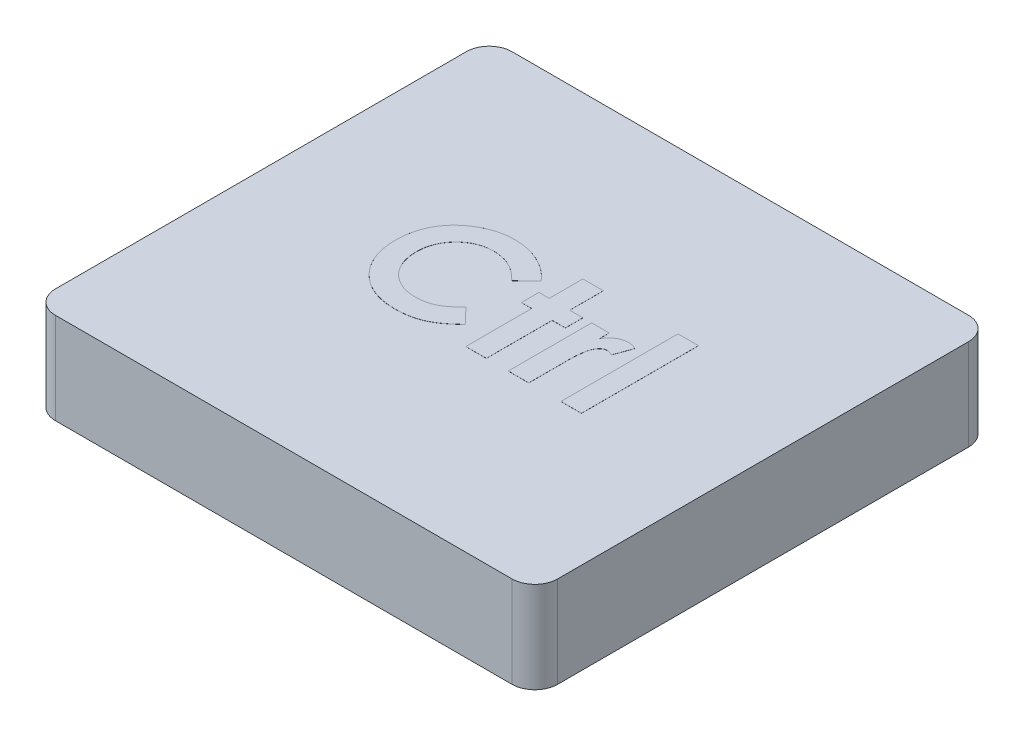
from build123d import *

# Parameters (mm, degrees)
SKETCH1_W           = 13.97
SKETCH1_H           = 12.7
BOSS_EXTRUDE1_DEPTH = 2.54
FILLET1_R           = 0.635
SHELL1_START        = 0.635
SHELL1_OUTLINE_W    = 1.905
SHELL1_OUTLINE_H    = 11.43
SHELL1_DEPTH        = 12.7
SKETCH2_R           = 2.54
BOSS_EXTRUDE2_DEPTH = 1.905
SKETCH3_W           = 0.569871795
SKETCH3_H           = 3.256410256
BOSS_EXTRUDE3_DEPTH = 0.00254


# Read off the part's stored shape, not the designer's step: Shell1
with BuildPart() as part:
    # Sketch1 → Boss-Extrude1 (new body)
    with BuildSketch(Plane(origin=(0, 0, 0), x_dir=(1, 0, 0), z_dir=(0, 1, 0))):
        with Locations((6.985, 6.35)):
            Rectangle(SKETCH1_W, SKETCH1_H)
    extrude(amount=BOSS_EXTRUDE1_DEPTH)

    # Fillet1
    fillet1_edges = [part.edges().sort_by_distance(p)[0] for p in [
        (0, 1.27, -12.7),
        (13.97, 1.27, -12.7),
        (13.97, 1.27, 0),
        (0, 1.27, 0),
    ]]
    fillet(fillet1_edges, radius=FILLET1_R)

    # Shell1 outline → Shell1 (cut)
    with BuildSketch(Plane.YZ.offset(SHELL1_START)):
        with Locations((0.9525, -6.35)):
            Rectangle(SHELL1_OUTLINE_W, SHELL1_OUTLINE_H)
    extrude(amount=SHELL1_DEPTH, mode=Mode.SUBTRACT)

    # Sketch2 → Boss-Extrude2 (add)
    with BuildSketch(Plane(origin=(0, 1.905, 0), x_dir=(-1, 0, 0), z_dir=(0, -1, 0))):
        with Locations(Location((-6.985, 6.35, 0), (0, 0, 270))):
            Circle(SKETCH2_R)
    extrude(amount=BOSS_EXTRUDE2_DEPTH)

    # Sketch3 → Boss-Extrude3 (add)
    with BuildSketch(Plane(origin=(0, 2.54, 0), x_dir=(1, 0, 0), z_dir=(0, 1, 0))):
        with BuildLine():
            Line((6.568505128, 7.577208734), (6.150641546, 7.177789663))
            add(Edge.make_bspline(
                [(6.150641546, 7.177789663), (6.115194953, 7.2144415), (6.045956652, 7.28603402), (5.934387691, 7.380816208), (5.818360035, 7.459804336), (5.700130769, 7.526327635), (5.577573291, 7.576657252), (5.452104701, 7.613333291), (5.322923843, 7.635693286), (5.235499207, 7.638251666), (5.191526963, 7.639538462)],
                knots=[0, 0, 0, 0, 1.115251505, 2.178435587, 3.19620269, 4.182487026, 5.141301733, 6.088180966, 7.038406374, 8, 8, 8, 8], degree=3))
            add(Edge.make_bspline(
                [(5.191526963, 7.639538462), (5.154804796, 7.638521848), (5.082337645, 7.636515672), (4.975936877, 7.621808428), (4.874159044, 7.596798119), (4.776655743, 7.562329281), (4.683713883, 7.517728433), (4.5951386, 7.463030097), (4.511148271, 7.398728275), (4.432852361, 7.325155668), (4.361230014, 7.244772066), (4.29794711, 7.159002955), (4.244937527, 7.068044826), (4.201433425, 6.972818837), (4.16754541, 6.872884235), (4.143345111, 6.7683083), (4.129348304, 6.658966489), (4.127259187, 6.584636741), (4.126197436, 6.546860176)],
                knots=[0, 0, 0, 0, 1.035432265, 2.043311493, 3.022114605, 3.98653278, 4.95457646, 5.923598177, 6.917315552, 7.932509744, 8.948865224, 9.949768934, 10.933144597, 11.912367597, 12.897413939, 13.903909035, 14.934704909, 16, 16, 16, 16], degree=3))
            add(Edge.make_bspline(
                [(4.126197436, 6.546860176), (4.12650342, 6.52034594), (4.127106522, 6.468085836), (4.133708537, 6.390778637), (4.144339337, 6.315772378), (4.159724739, 6.243180674), (4.178964335, 6.172940615), (4.201536762, 6.104446244), (4.229853539, 6.038643999), (4.26128559, 5.974769629), (4.297840702, 5.914566028), (4.337253857, 5.857156898), (4.379990988, 5.802823652), (4.426328908, 5.751788408), (4.476919763, 5.704848731), (4.530455968, 5.660593089), (4.587840605, 5.620129351), (4.647881648, 5.582442035), (4.711097778, 5.549702743), (4.775773793, 5.52004727), (4.842890313, 5.495962616), (4.911630153, 5.476548188), (4.981747662, 5.460039117), (5.053928654, 5.449873974), (5.12754741, 5.442176031), (5.177301332, 5.441700728), (5.202339263, 5.441461538)],
                knots=[0, 0, 0, 0, 1.103660481, 2.175337485, 3.227646561, 4.255952547, 5.262355991, 6.258840057, 7.255597736, 8.242457506, 9.22035537, 10.185017736, 11.140346927, 12.096287581, 13.051739095, 14.01125915, 14.986044842, 15.97314143, 16.960198552, 17.947847494, 18.933482797, 19.925264591, 20.920966487, 21.929612487, 22.958107872, 24, 24, 24, 24], degree=3))
            add(Edge.make_bspline(
                [(5.202339263, 5.441461538), (5.244807897, 5.442689957), (5.328247719, 5.445103479), (5.450707656, 5.463976883), (5.567399775, 5.495022564), (5.66063622, 5.53168571), (5.733684512, 5.567891042), (5.789295097, 5.601379191), (5.846800776, 5.638839363), (5.905246429, 5.681685345), (5.965289454, 5.729402968), (6.025869952, 5.783037337), (6.088538796, 5.840822348), (6.129592535, 5.882064647), (6.150641546, 5.903210337)],
                knots=[0, 0, 0, 0, 1.404581149, 2.759636711, 4.088442092, 5.392261763, 6.066678138, 6.783632037, 7.538459478, 8.336747902, 9.180226004, 10.074962426, 11.012997595, 12, 12, 12, 12], degree=3))
            Line((6.150641546, 5.903210337), (6.555784776, 5.477714543))
            add(Edge.make_bspline(
                [(6.555784776, 5.477714543), (6.527305387, 5.450218588), (6.471719712, 5.396552363), (6.387870264, 5.320351332), (6.304126343, 5.251876235), (6.222511029, 5.188641725), (6.141687378, 5.132489979), (6.06166396, 5.083364915), (5.983346676, 5.04002409), (5.905109243, 5.003198427), (5.826464826, 4.971929614), (5.745548963, 4.945009219), (5.662114287, 4.922235533), (5.575651216, 4.903860159), (5.486966225, 4.88912559), (5.395229341, 4.879179841), (5.301022221, 4.872493645), (5.237120072, 4.871892834), (5.204883333, 4.871589744)],
                knots=[0, 0, 0, 0, 1.244526981, 2.429050516, 3.560637417, 4.644440555, 5.67424972, 6.652764056, 7.595344123, 8.486817594, 9.369275933, 10.254498637, 11.166417451, 12.086725134, 13.032340136, 13.991389299, 14.986715468, 16, 16, 16, 16], degree=3))
            add(Edge.make_bspline(
                [(5.204883333, 4.871589744), (5.145668437, 4.873099249), (5.029801344, 4.876052933), (4.86000114, 4.897937726), (4.698695505, 4.934627196), (4.545492012, 4.986516227), (4.400439375, 5.052802032), (4.263574704, 5.134065316), (4.135118595, 5.230090176), (4.016108719, 5.339751107), (3.908458622, 5.460862399), (3.813308403, 5.590902701), (3.734600139, 5.730511114), (3.669246971, 5.877625175), (3.618141653, 6.032916222), (3.582172173, 6.196552234), (3.559990057, 6.36837521), (3.557563302, 6.485734263), (3.556325641, 6.545588141)],
                knots=[0, 0, 0, 0, 1.078019885, 2.10938526, 3.111377082, 4.085535484, 5.04941344, 6.010039228, 6.978205633, 7.964457913, 8.951525778, 9.924444315, 10.892603023, 11.863865945, 12.85144698, 13.863884204, 14.910567087, 16, 16, 16, 16], degree=3))
            add(Edge.make_bspline(
                [(3.556325641, 6.545588141), (3.556848616, 6.58462433), (3.557885026, 6.661984515), (3.568777786, 6.775942336), (3.583962928, 6.887030827), (3.608052774, 6.994096523), (3.637090707, 7.098581794), (3.673203193, 7.199351009), (3.716332553, 7.296693788), (3.765088628, 7.390773089), (3.820245888, 7.480972592), (3.881862603, 7.56651734), (3.948352517, 7.648067724), (4.021313276, 7.724541827), (4.099684664, 7.796611105), (4.183820519, 7.863885002), (4.273214805, 7.927328301), (4.36810948, 7.985304953), (4.466660994, 8.037747916), (4.567626351, 8.08400485), (4.670757492, 8.122664994), (4.775618369, 8.154732158), (4.882652019, 8.178668028), (4.991094461, 8.19678671), (5.101868412, 8.206915169), (5.176243523, 8.208573262), (5.21378758, 8.209410256)],
                knots=[0, 0, 0, 0, 1.071919942, 2.124283339, 3.142214191, 4.149696895, 5.136002878, 6.119640489, 7.086990633, 8.058538607, 9.028339693, 9.988281803, 10.952401235, 11.916291999, 12.888973767, 13.874849856, 14.873389453, 15.898127285, 16.927174885, 17.938320013, 18.946391617, 19.950418109, 20.947802303, 21.956882652, 22.968648068, 24, 24, 24, 24], degree=3))
            add(Edge.make_bspline(
                [(5.21378758, 8.209410256), (5.24581651, 8.20893047), (5.309541359, 8.207975887), (5.404438353, 8.200018393), (5.498576405, 8.187521229), (5.591618472, 8.168665671), (5.684230086, 8.14628174), (5.775194226, 8.11697307), (5.865945903, 8.084303034), (5.955061809, 8.045252678), (6.042666337, 8.002625686), (6.126707215, 7.954263816), (6.20859548, 7.903143202), (6.286516537, 7.846238304), (6.361930016, 7.785613168), (6.434441572, 7.720984943), (6.503414876, 7.651276087), (6.546698691, 7.602022665), (6.568505128, 7.577208734)],
                knots=[0, 0, 0, 0, 0.996412454, 1.982464992, 2.961075852, 3.949442424, 4.934965278, 5.923860011, 6.921385422, 7.934793307, 8.949617135, 9.951082467, 10.950285876, 11.951772932, 12.951063433, 13.960125323, 14.972308753, 16, 16, 16, 16], degree=3))
        make_face()
        Polygon((7.097671795, 8.209410256), (7.66754359, 8.209410256), (7.66754359, 7.273192308), (8.033889744, 7.273192308), (8.033889744, 6.784730769), (7.66754359, 6.784730769), (7.66754359, 4.953), (7.097671795, 4.953), (7.097671795, 6.784730769), (6.812735897, 6.784730769), (6.812735897, 7.273192308), (7.097671795, 7.273192308), align=None)
        with BuildLine():
            Line((8.278120513, 7.273192308), (8.766582051, 7.273192308))
            Line((8.766582051, 7.273192308), (8.766582051, 6.987620393))
            add(Edge.make_bspline(
                [(8.766582051, 6.987620393), (8.78039969, 7.012999247), (8.80740684, 7.062603272), (8.857021237, 7.129186851), (8.914020267, 7.185261684), (8.976355778, 7.232000626), (9.044216695, 7.268429043), (9.115785825, 7.294388882), (9.190450896, 7.31125918), (9.241384876, 7.313011685), (9.267127925, 7.313897436)],
                knots=[0, 0, 0, 0, 1.09866127, 2.147379032, 3.14564304, 4.131443017, 5.102343063, 6.064490016, 7.021754664, 8, 8, 8, 8], degree=3))
            add(Edge.make_bspline(
                [(9.267127925, 7.313897436), (9.28582059, 7.313022129), (9.323885533, 7.311239691), (9.381901861, 7.300878355), (9.440755263, 7.282143087), (9.479485873, 7.265274469), (9.499274359, 7.256655849)],
                knots=[0, 0, 0, 0, 0.931404136, 1.896671404, 2.925354185, 4, 4, 4, 4], degree=3))
            Line((9.499274359, 7.256655849), (9.322461458, 6.77391847))
            add(Edge.make_bspline(
                [(9.322461458, 6.77391847), (9.30665691, 6.781554463), (9.276950443, 6.795907192), (9.233821811, 6.81284489), (9.194680789, 6.823179446), (9.1698661, 6.824721452), (9.15836891, 6.825435897)],
                knots=[0, 0, 0, 0, 1.214386998, 2.282580073, 3.20428172, 4, 4, 4, 4], degree=3))
            add(Edge.make_bspline(
                [(9.15836891, 6.825435897), (9.147513328, 6.824962468), (9.126158527, 6.824031151), (9.094639437, 6.816050083), (9.064955019, 6.802286977), (9.035674781, 6.784655073), (9.009108609, 6.760145407), (8.982558846, 6.731771118), (8.959161774, 6.696739283), (8.934471077, 6.657747072), (8.913447831, 6.610020641), (8.895421046, 6.553045117), (8.879359035, 6.486161255), (8.868306178, 6.409013934), (8.857623149, 6.322349687), (8.851264348, 6.225532411), (8.846525052, 6.118868249), (8.846235276, 6.044412815), (8.846084255, 6.005609175)],
                knots=[0, 0, 0, 0, 0.544232178, 1.070598461, 1.618251235, 2.182094276, 2.777567932, 3.425210017, 4.127676488, 4.886675562, 5.738955394, 6.734782583, 7.883056018, 9.186093582, 10.642914445, 12.264202625, 14.053029461, 16, 16, 16, 16], degree=3))
            Line((8.846084255, 6.005609175), (8.847992308, 5.892398037))
            Line((8.847992308, 5.892398037), (8.847992308, 4.953))
            Line((8.847992308, 4.953), (8.278120513, 4.953))
            Line((8.278120513, 4.953), (8.278120513, 7.273192308))
        make_face()
        with Locations((10.028441026, 6.581205128)):
            Rectangle(SKETCH3_W, SKETCH3_H)
    extrude(amount=BOSS_EXTRUDE3_DEPTH)


solid = part.part
